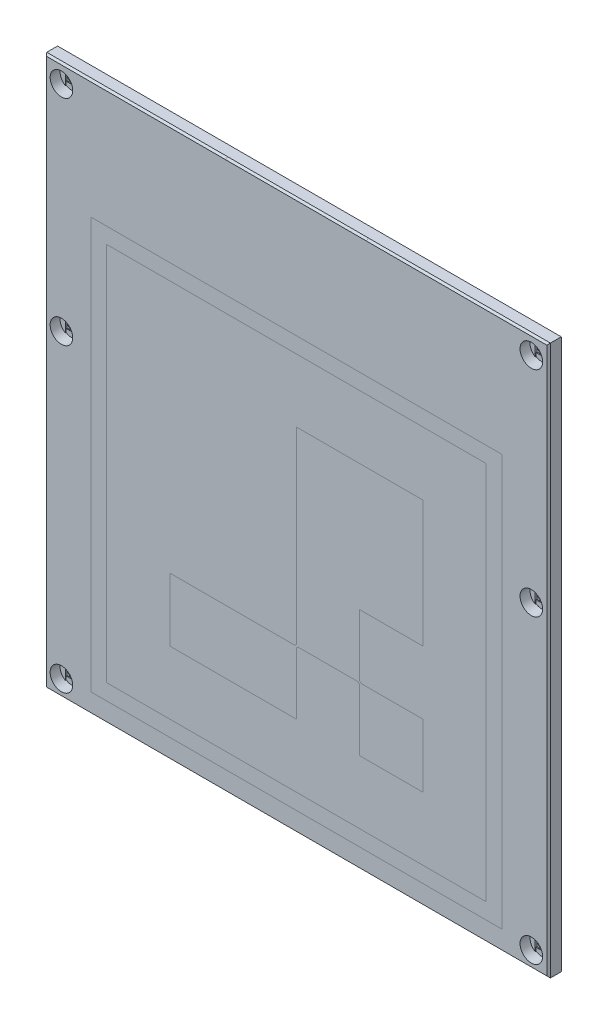
from build123d import *
from build123d.topology import SkipClean

# Parameters (mm, degrees)
SKETCH1_R           = 1.35
BOSS_EXTRUDE1_DEPTH = 2.8
SKETCH3_R           = 2.5
CUT_EXTRUDE1_DEPTH  = 2.2
SKETCH4_W           = 91.3
SKETCH4_H           = 85.4
CUT_EXTRUDE2_DEPTH  = 1.5
CUT_EXTRUDE3_DEPTH  = 0.2
SKETCH6_W           = 2.7
SKETCH6_H           = 2.7
CUT_EXTRUDE4_DEPTH  = 0.2
CHAMFER1_SIZE       = 0.4
SKETCH7_W           = 91
SKETCH7_H           = 91
CUT_EXTRUDE5_DEPTH  = 0.4
SKETCH8_W           = 91
SKETCH8_H           = 91
SKETCH8_W_2         = 84
SKETCH8_H_2         = 84
BOSS_EXTRUDE2_DEPTH = 0.4
CUT_EXTRUDE6_DEPTH  = 0.4
BOSS_EXTRUDE3_DEPTH = 0.4
BOSS_EXTRUDE4_START = -2.8
SKETCH11_W          = 31.175
SKETCH11_H          = 25.7
BOSS_EXTRUDE4_DEPTH = 2.8
CHAMFER2_SIZE       = 0.4


with BuildPart() as part:
    # Sketch1 → Boss-Extrude1 (new body)
    with BuildSketch(Plane.XY):
        Polygon((-15.25, 54.05), (-15.25, 28.75), (15.125, 28.75), (15.125, 54.05), (55.825, 54.05), (55.825, -67.65), (-55.65, -67.65), (-55.65, 54.05), align=None)
        with Locations((-52, 50)):
            Circle(SKETCH1_R, mode=Mode.SUBTRACT)
        with Locations((-52, 2.6)):
            Circle(SKETCH1_R, mode=Mode.SUBTRACT)
        with Locations((-52, -64)):
            Circle(SKETCH1_R, mode=Mode.SUBTRACT)
        with Locations((52, 50)):
            Circle(SKETCH1_R, mode=Mode.SUBTRACT)
        with Locations((52, 2.6)):
            Circle(SKETCH1_R, mode=Mode.SUBTRACT)
        with Locations((52, -64)):
            Circle(SKETCH1_R, mode=Mode.SUBTRACT)
    extrude(amount=BOSS_EXTRUDE1_DEPTH)

    # Sketch3 → Cut-Extrude1 (cut)
    with BuildSketch(Plane.XY.offset(2.8)):
        with Locations((-52, 50)):
            Circle(SKETCH3_R)
        with Locations((-52, 2.6)):
            Circle(SKETCH3_R)
        with Locations((-52, -64)):
            Circle(SKETCH3_R)
        with Locations((52, -64)):
            Circle(SKETCH3_R)
        with Locations((52, 2.6)):
            Circle(SKETCH3_R)
        with Locations((52, 50)):
            Circle(SKETCH3_R)
    extrude(amount=-CUT_EXTRUDE1_DEPTH, mode=Mode.SUBTRACT)

    # Sketch4 → Cut-Extrude2 (cut)
    with BuildSketch(Plane(origin=(0, 0, 0), x_dir=(-1, 0, 0), z_dir=(0, 0, -1))):
        with Locations((0, -14.95)):
            Rectangle(SKETCH4_W, SKETCH4_H)
    extrude(amount=-CUT_EXTRUDE2_DEPTH, mode=Mode.SUBTRACT)

    # Sketch5 → Cut-Extrude3 (cut)
    with SkipClean():  # the faces are left unmerged after this step: merging them gives an invalid solid
        with BuildSketch(Plane.XY.offset(0.6)):
            with BuildLine():
                Line((-53.35, 47.895837459), (-53.35, 52.104162541))
                ThreePointArc((-53.35, 52.104162541), (-52, 52.5), (-50.65, 52.104162541))
                Line((-50.65, 52.104162541), (-50.65, 47.895837459))
                ThreePointArc((-50.65, 47.895837459), (-52, 47.5), (-53.35, 47.895837459))
            make_face()
            with BuildLine():
                Line((-53.35, 0.495837459), (-53.35, 4.704162541))
                ThreePointArc((-53.35, 4.704162541), (-52, 5.1), (-50.65, 4.704162541))
                Line((-50.65, 4.704162541), (-50.65, 0.495837459))
                ThreePointArc((-50.65, 0.495837459), (-52, 0.1), (-53.35, 0.495837459))
            make_face()
            with BuildLine():
                Line((-53.35, -66.104162541), (-53.35, -61.895837459))
                ThreePointArc((-53.35, -61.895837459), (-52, -61.5), (-50.65, -61.895837459))
                Line((-50.65, -61.895837459), (-50.65, -66.104162541))
                ThreePointArc((-50.65, -66.104162541), (-52, -66.5), (-53.35, -66.104162541))
            make_face()
        cut_extrude3 = extrude(amount=-CUT_EXTRUDE3_DEPTH, mode=Mode.SUBTRACT)

    # Sketch6 → Cut-Extrude4 (cut)
    with SkipClean():  # the faces are left unmerged after this step: merging them gives an invalid solid
        with BuildSketch(Plane.XY.offset(0.4)):
            with Locations((-52, -64)):
                Rectangle(SKETCH6_W, SKETCH6_H)
            with Locations((-52, 2.6)):
                Rectangle(SKETCH6_W, SKETCH6_H)
            with Locations((-52, 50)):
                Rectangle(SKETCH6_W, SKETCH6_H)
        cut_extrude4 = extrude(amount=-CUT_EXTRUDE4_DEPTH, mode=Mode.SUBTRACT)

    # Mirror1: Cut-Extrude3, Cut-Extrude4 across plane
    with SkipClean():  # the faces are left unmerged after this step: merging them gives an invalid solid
        add(cut_extrude3.mirror(Plane(origin=(0, 0, 0), x_dir=(0, 0, 1), z_dir=(1, 0, 0))), mode=Mode.SUBTRACT)
        add(cut_extrude4.mirror(Plane(origin=(0, 0, 0), x_dir=(0, 0, 1), z_dir=(1, 0, 0))), mode=Mode.SUBTRACT)

    # Chamfer1
    chamfer1_edges = [part.edges().sort_by_distance(p)[0] for p in [
        (55.825, -6.8, 2.8),
        (35.475, 54.05, 2.8),
        (15.125, 41.4, 2.8),
        (-0.0625, 28.75, 2.8),
        (-15.25, 41.4, 2.8),
        (-35.45, 54.05, 2.8),
        (-55.65, -6.8, 2.8),
        (0.0875, -67.65, 2.8),
    ]]
    chamfer(chamfer1_edges, length=CHAMFER1_SIZE)

    # Sketch7 → Cut-Extrude5 (cut)
    with SkipClean():  # the faces are left unmerged after this step: merging them gives an invalid solid
        with BuildSketch(Plane.XY.offset(2.8)):
            with Locations((0, -17.75)):
                Rectangle(SKETCH7_W, SKETCH7_H)
            Polygon((28, 24.25), (42, 24.25), (42, 10.25), (42, -3.75), (42, -17.75), (42, -31.75), (42, -45.75), (42, -59.75), (28, -59.75), (14, -59.75), (0, -59.75), (-14, -59.75), (-28, -59.75), (-42, -59.75), (-42, -45.75), (-42, -31.75), (-42, -17.75), (-42, -3.75), (-42, 10.25), (-42, 24.25), (-28, 24.25), (-14, 24.25), (0, 24.25), (14, 24.25), align=None, mode=Mode.SUBTRACT)
        extrude(amount=-CUT_EXTRUDE5_DEPTH, mode=Mode.SUBTRACT)

    # Sketch9 → Cut-Extrude6 (cut)
    with SkipClean():  # the faces are left unmerged after this step: merging them gives an invalid solid
        with BuildSketch(Plane.XY.offset(2.8)):
            Polygon((-28, -31.75), (-28, -45.75), (-14, -45.75), (0, -45.75), (0, -32.103553391), (0.353553391, -31.75), (13.646446609, -31.75), (14, -32.103553391), (14, -45.75), (28, -45.75), (28, -31.75), (14.353553391, -31.75), (14, -31.396446609), (14, -17.75), (28, -17.75), (28, -3.75), (28, 10.25), (14, 10.25), (0, 10.25), (0, -3.75), (0, -17.75), (0, -31.396446609), (-0.353553391, -31.75), (-14, -31.75), align=None)
        extrude(amount=-CUT_EXTRUDE6_DEPTH, mode=Mode.SUBTRACT)

    # Sketch11 → Boss-Extrude4 (add)
    with SkipClean():  # the faces are left unmerged after this step: merging them gives an invalid solid
        with BuildSketch(Plane.XY.offset(2.8).offset(BOSS_EXTRUDE4_START)):
            with Locations((-0.0625, 41.2)):
                Rectangle(SKETCH11_W, SKETCH11_H)
        extrude(amount=BOSS_EXTRUDE4_DEPTH)

    # Chamfer2
    chamfer2_edges = [part.edges().sort_by_distance(p)[0] for p in [
        (-0.0625, 54.05, 2.8),
    ]]
    chamfer(chamfer2_edges, length=CHAMFER2_SIZE - 0.0001)  # a hair under: the kernel refuses the full size


with BuildPart() as body_2:
    # Sketch8 → Boss-Extrude2 (new body)
    with BuildSketch(Plane.XY.offset(2.4)):
        with Locations((0, -17.75)):
            Rectangle(SKETCH8_W, SKETCH8_H)
        with Locations((0, -17.75)):
            Rectangle(SKETCH8_W_2, SKETCH8_H_2, mode=Mode.SUBTRACT)
    extrude(amount=BOSS_EXTRUDE2_DEPTH)


with BuildPart() as body_3:
    # Sketch10 → Boss-Extrude3 (new body)
    with BuildSketch(Plane.XY.offset(2.4)):
        Polygon((28, -31.75), (14.353553391, -31.75), (14, -31.396446609), (14, -17.75), (28, -17.75), (28, 10.25), (0, 10.25), (0, -31.396446609), (-0.353553391, -31.75), (-28, -31.75), (-28, -45.75), (0, -45.75), (0, -32.103553391), (0.353553391, -31.75), (13.646446609, -31.75), (14, -32.103553391), (14, -45.75), (28, -45.75), align=None)
    extrude(amount=BOSS_EXTRUDE3_DEPTH)


solid = Compound([part.part, body_2.part, body_3.part])
